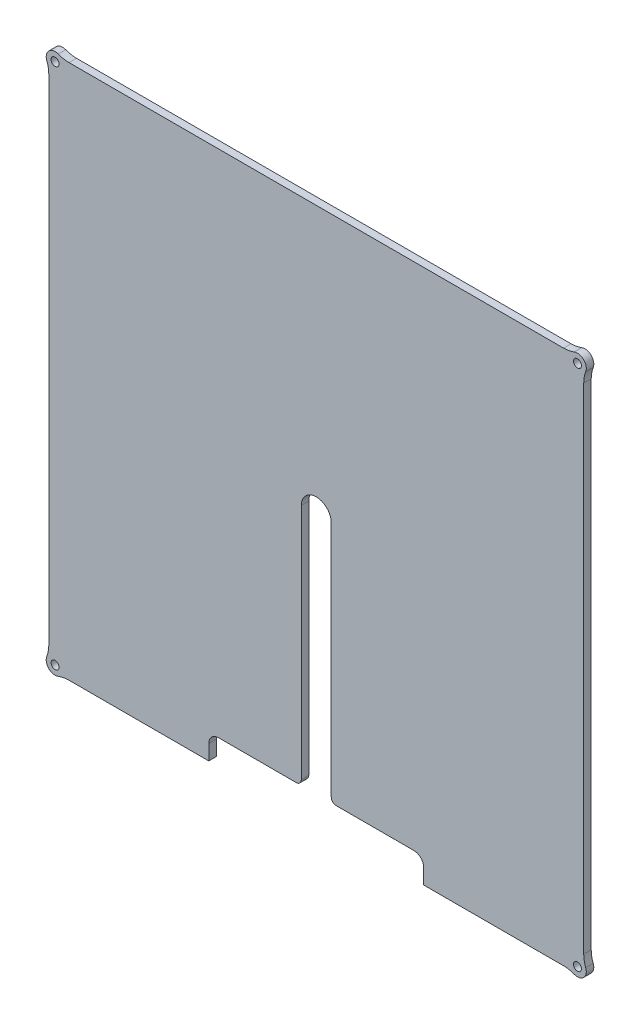
from build123d import *

# Parameters (mm, degrees)
SKETCH1_R           = 1.6
BOSS_EXTRUDE1_DEPTH = 3
CUT_EXTRUDE1_DEPTH  = 153.814767522
FILLET1_R           = 2


with BuildPart() as part:
    # Sketch1 → Boss-Extrude1 (new body)
    with BuildSketch(Plane.XY):
        with BuildLine():
            Line((-107, 98.923010333), (-107, -98.923010333))
            ThreePointArc((-107, -98.923010333), (-107.201661971, -101.11372249), (-107.799869959, -103.230804092))
            ThreePointArc((-107.799869959, -103.230804092), (-107, -107), (-103.230804092, -107.799869959))
            ThreePointArc((-103.230804092, -107.799869959), (-101.11372249, -107.201661971), (-98.923010333, -107))
            Line((-98.923010333, -107), (-43, -107))
            Line((-43, -107), (-43, -101))
            ThreePointArc((-43, -101), (-41.828427125, -98.171572875), (-39, -97))
            Line((-39, -97), (39, -97))
            ThreePointArc((39, -97), (41.828427125, -98.171572875), (43, -101))
            Line((43, -101), (43, -107))
            Line((43, -107), (98.923010333, -107))
            ThreePointArc((98.923010333, -107), (101.11372249, -107.201661971), (103.230804092, -107.799869959))
            ThreePointArc((103.230804092, -107.799869959), (107, -107), (107.799869959, -103.230804092))
            ThreePointArc((107.799869959, -103.230804092), (107.201661971, -101.11372249), (107, -98.923010333))
            Line((107, -98.923010333), (107, 98.923010333))
            ThreePointArc((107, 98.923010333), (107.201661971, 101.11372249), (107.799869959, 103.230804092))
            ThreePointArc((107.799869959, 103.230804092), (107, 107), (103.230804092, 107.799869959))
            ThreePointArc((103.230804092, 107.799869959), (101.11372249, 107.201661971), (98.923010333, 107))
            Line((98.923010333, 107), (-98.923010333, 107))
            ThreePointArc((-98.923010333, 107), (-101.11372249, 107.201661971), (-103.230804092, 107.799869959))
            ThreePointArc((-103.230804092, 107.799869959), (-107, 107), (-107.799869959, 103.230804092))
            ThreePointArc((-107.799869959, 103.230804092), (-107.201661971, 101.11372249), (-107, 98.923010333))
        make_face()
        with Locations((-104.5, -104.5)):
            Circle(SKETCH1_R, mode=Mode.SUBTRACT)
        with Locations((-104.5, 104.5)):
            Circle(SKETCH1_R, mode=Mode.SUBTRACT)
        with Locations((104.5, 104.5)):
            Circle(SKETCH1_R, mode=Mode.SUBTRACT)
        with Locations((104.5, -104.5)):
            Circle(SKETCH1_R, mode=Mode.SUBTRACT)
    extrude(amount=BOSS_EXTRUDE1_DEPTH)

    # Sketch2 → Cut-Extrude1 (cut, through all)
    with BuildSketch(Plane(origin=(0, 0, 0), x_dir=(-1, 0, 0), z_dir=(0, 0, -1))):
        with BuildLine():
            Line((6, -97), (-6, -97))
            Line((-6, -97), (-6, 0))
            ThreePointArc((-6, 0), (0, 6), (6, 0))
            Line((6, 0), (6, -97))
        make_face()
    extrude(amount=-CUT_EXTRUDE1_DEPTH, mode=Mode.SUBTRACT)

    # Fillet1
    fillet1_edges = [part.edges().sort_by_distance(p)[0] for p in [
        (-6, -97, 1.5),
        (6, -97, 1.5),
    ]]
    fillet(fillet1_edges, radius=FILLET1_R)


solid = part.part
